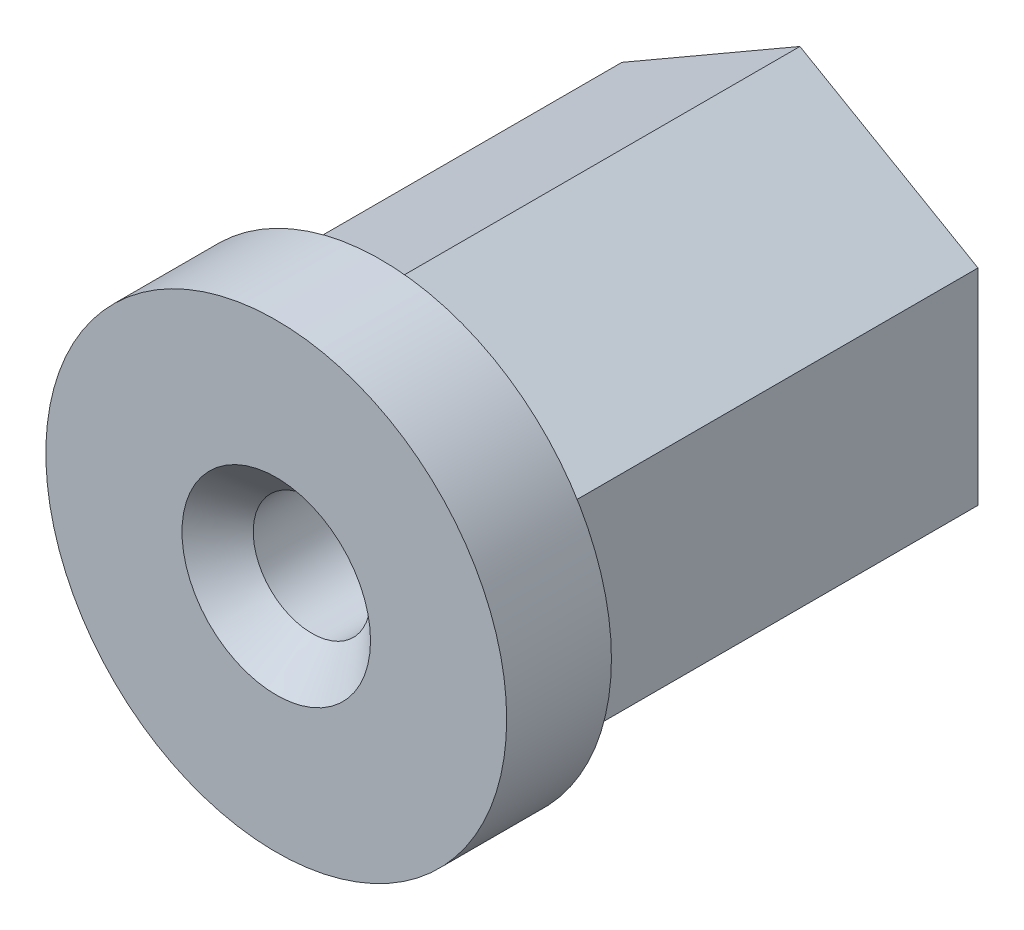
from build123d import *

# Parameters (mm, degrees)
ESQUISSE1_R                                    = 6
BOSS_EXTRU_1_DEPTH                             = 15
FILETAGE1_PITCH                                = 1.5
BOSS_EXTRU_2_DEPTH                             = 2
BOSS_EXTRU_3_DEPTH                             = 8
FRAISAGE_POUR_VIS_T_TE_FRAIS_E_M61_D           = 5.6
FRAISAGE_POUR_VIS_T_TE_FRAIS_E_M61_CSINK_D     = 9
FRAISAGE_POUR_VIS_T_TE_FRAIS_E_M61_CSINK_ANGLE = 90
ESQUISSE11_R                                   = 11
ESQUISSE11_R_2                                 = 4.5
BOSS_EXTRU_4_DEPTH                             = 5


with BuildPart() as part:
    # Esquisse1 → Boss.-Extru.1 (new body)
    with BuildSketch(Plane(origin=(0, 0, 0), x_dir=(0, 1, 0), z_dir=(0, 0, 1))):
        Polygon((9.814954576, 0), (4.907477288, 8.5), (-4.907477288, 8.5), (-9.814954576, 0), (-4.907477288, -8.5), (4.907477288, -8.5), align=None)
        with Locations(Location((0, 0, 0), (0, 0, 270))):
            Circle(ESQUISSE1_R, mode=Mode.SUBTRACT)
    extrude(amount=BOSS_EXTRU_1_DEPTH)

    # Filetage1: the profile of Profil de filetage1 profile screwed along a right-hand helix of 10 turns, 8 arcs to a turn; built about Z, then put on its axis
    filetage1_z = Axis((0, 0, 0), (0, 0, 1))
    filetage1_corners = [(5.9997, 0, -0.000173205), (6.811898813, 0, 0.468749998), (6.811898813, 0, 0.656249998), (5.9997, 0, 1.125173201)]
    with BuildLine(mode=Mode.PRIVATE) as filetage1_profile:
        Line(filetage1_corners[0], filetage1_corners[1])
        Line(filetage1_corners[1], filetage1_corners[2])
        Line(filetage1_corners[2], filetage1_corners[3])
        Line(filetage1_corners[3], filetage1_corners[0])
    filetage1_cap = Face(filetage1_profile.wire())
    filetage1_turn_angles = [0, 22.5, 45, 67.5, 90, 112.5, 135, 157.5, 180, 202.5, 225, 247.5, 270, 292.5, 315, 337.5, 360]
    filetage1_turn_weights = [1, 0.9238795325112867, 1, 0.9238795325112867, 1, 0.9238795325112867, 1, 0.9238795325112867, 1, 0.9238795325112867, 1, 0.9238795325112867, 1, 0.9238795325112867, 1, 0.9238795325112867, 1]
    filetage1_turn_rails = [Edge.make_bspline([Vector(p[0], p[1], 0).rotate(filetage1_z, filetage1_turn_angles[k]) / filetage1_turn_weights[k] + Vector(0, 0, p[2] + FILETAGE1_PITCH * filetage1_turn_angles[k] / 360) for k in range(17)], [0, 0, 0, 1, 1, 2, 2, 3, 3, 4, 4, 5, 5, 6, 6, 7, 7, 8, 8, 8], 2, filetage1_turn_weights) for p in filetage1_corners]
    filetage1_turn_sides = [Face.make_surface_from_curves(filetage1_turn_rails[p[0]], filetage1_turn_rails[p[1]]) for p in [(0, 1), (1, 2), (2, 3), (3, 0)]]
    filetage1 = Plane(origin=(0, 0, 15), x_dir=(-1, 0, 0), z_dir=(0, 0, -1)) * Solid(Shell([*[p.moved(Location((0, 0, FILETAGE1_PITCH * i))) for i in range(10) for p in filetage1_turn_sides], filetage1_cap, filetage1_cap.rotate(filetage1_z, 3600).moved(Location((0, 0, FILETAGE1_PITCH * 3600 / 360)))]))
    add(filetage1, mode=Mode.SUBTRACT)

    # Esquisse5 → Boss.-Extru.2 (add)
    with BuildSketch(Plane.XY.offset(15)):
        Polygon((8.5, -4.907477288), (8.5, 4.907477288), (0, 9.814954576), (-8.5, 4.907477288), (-8.5, -4.907477288), (0, -9.814954576), align=None)
    extrude(amount=BOSS_EXTRU_2_DEPTH)

    # Esquisse8 → Boss.-Extru.3 (add)
    with BuildSketch(Plane.XY.offset(17)):
        Polygon((8.5, 4.907477288), (0, 9.814954576), (-8.5, 4.907477288), (-8.5, -4.907477288), (0, -9.814954576), (8.5, -4.907477288), align=None)
    extrude(amount=BOSS_EXTRU_3_DEPTH)

    # Fraisage pour vis à tête fraisée M61 (through all)
    with Locations(Plane.XY.offset(25)):
        with Locations((0, 0)):
            CounterSinkHole(FRAISAGE_POUR_VIS_T_TE_FRAIS_E_M61_D / 2, FRAISAGE_POUR_VIS_T_TE_FRAIS_E_M61_CSINK_D / 2, counter_sink_angle=FRAISAGE_POUR_VIS_T_TE_FRAIS_E_M61_CSINK_ANGLE)

    # Esquisse11 → Boss.-Extru.4 (add)
    with BuildSketch(Plane.XY.offset(25)):
        Circle(ESQUISSE11_R)
        Circle(ESQUISSE11_R_2, mode=Mode.SUBTRACT)
    extrude(amount=-BOSS_EXTRU_4_DEPTH)


solid = part.part
